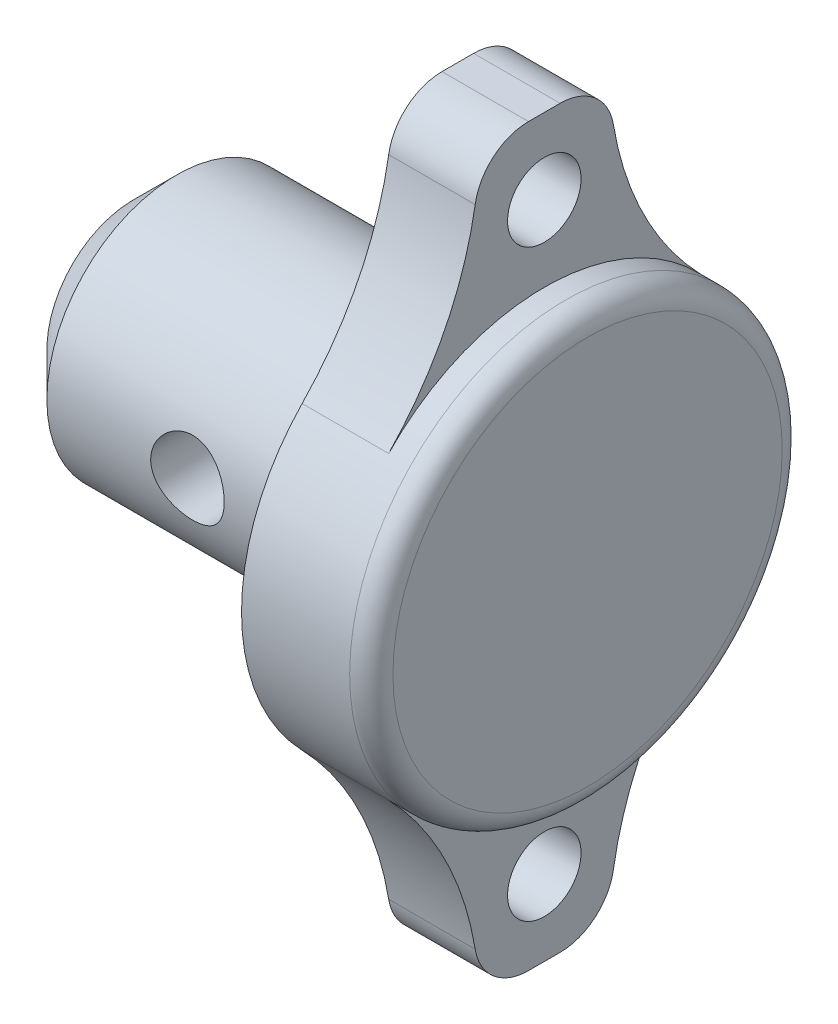
from build123d import *

# Parameters (mm, degrees)
CROQUIS1_R               = 6
SALIENTE_EXTRUIR1_DEPTH  = 7.5
CROQUIS2_R               = 10
SALIENTE_EXTRUIR2_DEPTH  = 6
CORTAR_EXTRUIR1_START    = -2.5
CROQUIS3_R               = 8.5
CROQUIS3_R_2             = 6
CORTAR_EXTRUIR1_DEPTH    = 2.5
CROQUIS4_R               = 1.7
SALIENTE_EXTRUIR3_DEPTH  = 4
REDONDEO1_R              = 15
CROQUIS5_R               = 1.7
CORTAR_EXTRUIR2_DEPTH    = 6.5
REDONDEO1_OF_SIMETR_A1_R = 15
REDONDEO2_R              = 2.5
CHAFL_N1_SIZE            = 2
REDONDEO3_R              = 1


with BuildPart() as part:
    # Croquis1 → Saliente-Extruir1 (new, symmetric)
    with BuildSketch(Plane(origin=(0, 0, 0), x_dir=(0, 0, -1), z_dir=(1, 0, 0))):
        Circle(CROQUIS1_R)
    extrude(amount=SALIENTE_EXTRUIR1_DEPTH, both=True)

    # Croquis2 → Saliente-Extruir2 (add)
    with BuildSketch(Plane(origin=(7.5, 0, 0), x_dir=(0, 0, -1), z_dir=(1, 0, 0))):
        Circle(CROQUIS2_R)
    extrude(amount=SALIENTE_EXTRUIR2_DEPTH)

    # Croquis3 → Cortar-Extruir1 (cut)
    with BuildSketch(Plane.ZY.offset(-7.5).offset(CORTAR_EXTRUIR1_START)):
        Circle(CROQUIS3_R)
        Circle(CROQUIS3_R_2, mode=Mode.SUBTRACT)
    extrude(amount=CORTAR_EXTRUIR1_DEPTH, mode=Mode.SUBTRACT)

    # Croquis4 → Saliente-Extruir3 (add)
    with BuildSketch(Plane.ZY.offset(-7.5)):
        with BuildLine():
            Line((3, -9.539392014), (3, -17))
            Line((3, -17), (-3, -17))
            Line((-3, -17), (-3, -9.539392014))
            ThreePointArc((-3, -9.539392014), (0, -10), (3, -9.539392014))
        make_face()
        with Locations((0, -13.5)):
            Circle(CROQUIS4_R, mode=Mode.SUBTRACT)
    saliente_extruir3 = extrude(amount=-SALIENTE_EXTRUIR3_DEPTH)

    # Redondeo1
    # the kernel refuses this fillet: 15 mm, written as the material it adds along each edge
    with BuildSketch(Plane(origin=(7.5, -9.539392014, -3), x_dir=(0, 0.5262014079949279, -0.8503599697917085), z_dir=(1, 0, 0))) as redondeo1_piece_1:
        with BuildLine():
            CenterArc((8.6399656, -14.535781993), REDONDEO1_R, 104.291553589, 42.60821753)
            Line((-3.925782427, -6.344202381), (-4.177097387, -6.180370789))
            ThreePointArc((-4.177097387, -6.180370789), (-2.217999204, -3.014240768), (-0.255107991, 0.157860422))
            Line((-0.255107991, 0.157860422), (0.074056848, 0.29071564))
            ThreePointArc((0.074056848, 0.29071564), (2.4685616, -0.009478671), (4.863066352, 0.29071564))
            Line((4.863066352, 0.29071564), (4.9371232, 0))
        make_face()
    extrude(amount=4)
    with BuildSketch(Plane(origin=(7.5, -9.539392014, 3), x_dir=(0, 0.5262014079949285, 0.8503599697917081), z_dir=(1, 0, 0))) as redondeo1_piece_2:
        with BuildLine():
            CenterArc((8.6399656, 14.535781993), REDONDEO1_R, 213.100228881, 42.60821753)
            Line((-3.925782427, 6.344202381), (-4.177097387, 6.180370789))
            ThreePointArc((-4.177097387, 6.180370789), (-2.217999204, 3.014240768), (-0.255107991, -0.157860422))
            Line((-0.255107991, -0.157860422), (0.074056848, -0.29071564))
            ThreePointArc((0.074056848, -0.29071564), (2.4685616, 0.009478671), (4.863066352, -0.29071564))
            Line((4.863066352, -0.29071564), (4.9371232, 0))
        make_face()
    extrude(amount=4)

    # Croquis5 → Cortar-Extruir2 (cut, symmetric)
    with BuildSketch(Plane.XY):
        with Locations((1, 0)):
            Circle(CROQUIS5_R)
    extrude(amount=CORTAR_EXTRUIR2_DEPTH, both=True, mode=Mode.SUBTRACT)

    # Simetría1: Saliente-Extruir3 across plane
    add(saliente_extruir3.mirror(Plane.ZX))

    # Redondeo1 of Simetría1
    # the kernel refuses this fillet: 15 mm, written as the material it adds along each edge
    with BuildSketch(Plane(origin=(7.5, 9.539392014, -3), x_dir=(0, -0.526201407994929, -0.8503599697917078), z_dir=(1, 0, 0))) as redondeo1_of_simetr_a1_piece_1:
        with BuildLine():
            CenterArc((8.6399656, 14.535781993), REDONDEO1_OF_SIMETR_A1_R, 213.100228881, 42.60821753)
            Line((-3.925782427, 6.344202381), (-4.177097387, 6.180370789))
            ThreePointArc((-4.177097387, 6.180370789), (-2.217999204, 3.014240768), (-0.255107991, -0.157860422))
            Line((-0.255107991, -0.157860422), (0.074056848, -0.29071564))
            ThreePointArc((0.074056848, -0.29071564), (2.4685616, 0.009478671), (4.863066352, -0.29071564))
            Line((4.863066352, -0.29071564), (4.9371232, 0))
        make_face()
    extrude(amount=4)
    with BuildSketch(Plane(origin=(7.5, 9.539392014, 3), x_dir=(0, -0.5262014079949293, 0.8503599697917078), z_dir=(1, 0, 0))) as redondeo1_of_simetr_a1_piece_2:
        with BuildLine():
            CenterArc((8.6399656, -14.535781993), REDONDEO1_OF_SIMETR_A1_R, 104.291553589, 42.60821753)
            Line((-3.925782427, -6.344202381), (-4.177097387, -6.180370789))
            ThreePointArc((-4.177097387, -6.180370789), (-2.217999204, -3.014240768), (-0.255107991, 0.157860422))
            Line((-0.255107991, 0.157860422), (0.074056848, 0.29071564))
            ThreePointArc((0.074056848, 0.29071564), (2.4685616, -0.009478671), (4.863066352, 0.29071564))
            Line((4.863066352, 0.29071564), (4.9371232, 0))
        make_face()
    extrude(amount=4)

    # Redondeo2
    redondeo2_edges = [part.edges().sort_by_distance(p)[0] for p in [
        (9.5, -17, 3),
        (9.5, -17, -3),
        (9.5, 17, -3),
        (9.5, 17, 3),
    ]]
    fillet(redondeo2_edges, radius=REDONDEO2_R)

    # Chaflán1
    chafl_n1_edges = [part.edges().sort_by_distance(p)[0] for p in [
        (-7.5, 0, 6),
    ]]
    chamfer(chafl_n1_edges, length=CHAFL_N1_SIZE)

    # Redondeo3
    redondeo3_edges = [part.edges().sort_by_distance(p)[0] for p in [
        (13.5, 0, 10),
    ]]
    fillet(redondeo3_edges, radius=REDONDEO3_R)


solid = part.part
